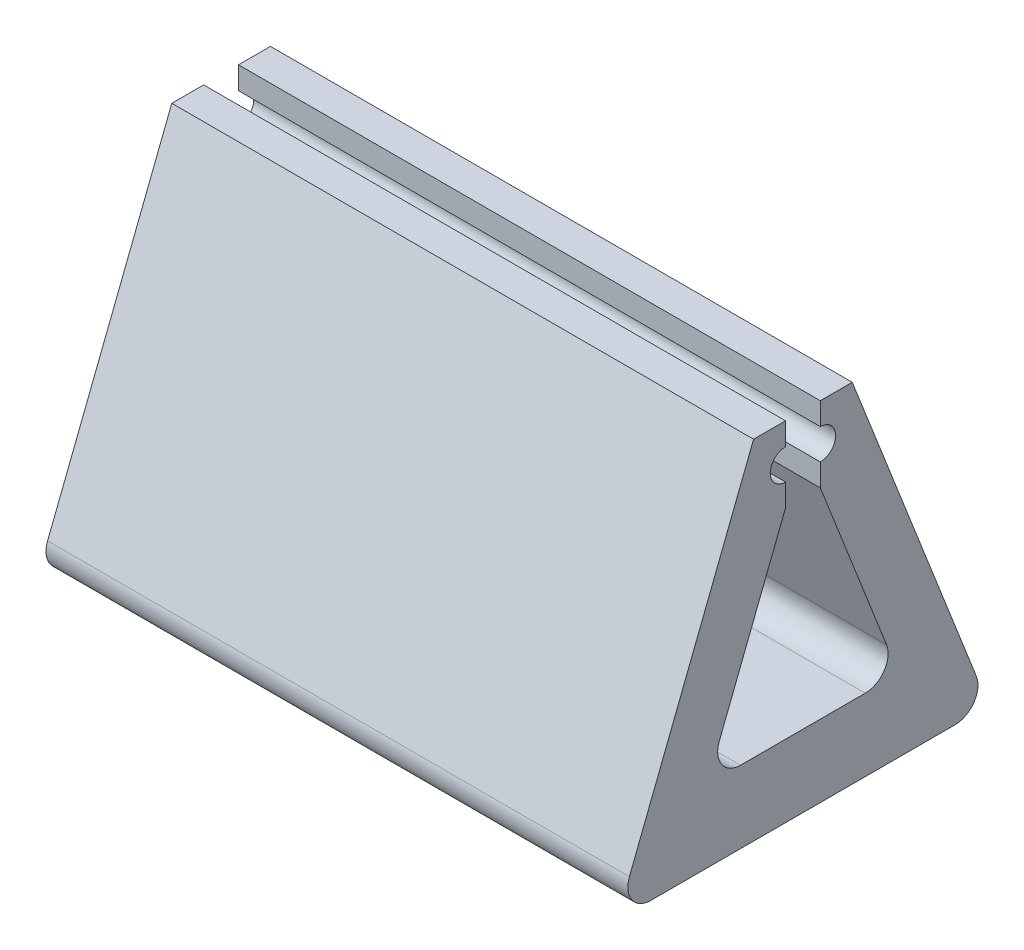
from build123d import *

# Parameters (mm, degrees)
BOSS_EXTRUDE1_DEPTH = 15.24


with BuildPart() as part:
    # Sketch1 → Boss-Extrude1 (new body)
    with BuildSketch(Plane(origin=(0, 0, 0), x_dir=(0, 0, -1), z_dir=(1, 0, 0))):
        with BuildLine():
            Line((-0.456, 6.634870585), (-0.456, 7.223602414))
            Line((-0.456, 7.223602414), (-1.291901407, 7.223602414))
            Line((-1.291901407, 7.223602414), (-4.545259488, -1.074831241))
            ThreePointArc((-4.545259488, -1.074831241), (-4.482335131, -1.631913114), (-3.986654303, -1.893829521))
            Line((-3.986654303, -1.893829521), (3.986654303, -1.893829521))
            ThreePointArc((3.986654303, -1.893829521), (4.482335131, -1.631913114), (4.545259488, -1.074831241))
            Line((4.545259488, -1.074831241), (1.291901407, 7.223602414))
            Line((1.291901407, 7.223602414), (0.456, 7.223602414))
            Line((0.456, 7.223602414), (0.456, 6.634870585))
            ThreePointArc((0.456, 6.634870585), (0.856, 6.234870585), (0.456, 5.834870585))
            Line((0.456, 5.834870585), (0.456, 5.246138756))
            Line((0.456, 5.246138756), (2.191637573, 0.81899828))
            ThreePointArc((2.191637573, 0.81899828), (2.128713216, 0.261916407), (1.633032387, 0))
            Line((1.633032387, 0), (0, 0))
            Line((0, 0), (-1.633032387, 0))
            ThreePointArc((-1.633032387, 0), (-2.128713216, 0.261916407), (-2.191637573, 0.81899828))
            Line((-2.191637573, 0.81899828), (-0.456, 5.246138756))
            Line((-0.456, 5.246138756), (-0.456, 5.834870585))
            ThreePointArc((-0.456, 5.834870585), (-0.856, 6.234870585), (-0.456, 6.634870585))
        make_face()
    extrude(amount=BOSS_EXTRUDE1_DEPTH)


solid = part.part
